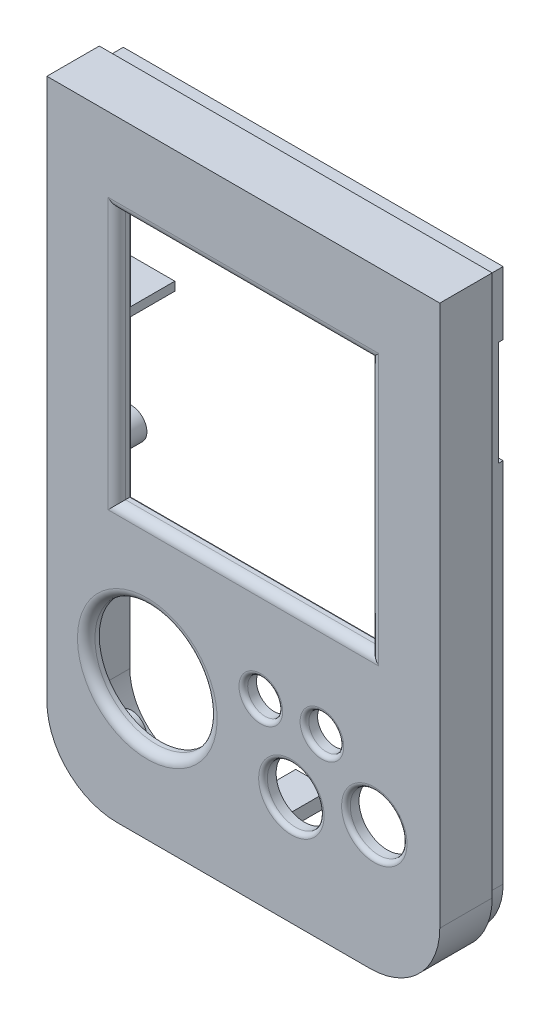
from build123d import *

# Parameters (mm, degrees)
EXTRUDE_1_DEPTH     = 8
SHELL_2_T           = -1.5
SKETCH_4_R          = 7
SKETCH_4_R_2        = 3.25
SKETCH_4_R_3        = 2
SKETCH_4_W          = 29
SKETCH_4_H          = 29
CUT_EXTRUDE_3_DEPTH = 84.600239234
FILLET_1_R          = 1
FILLET_2_R          = 1
FILLET_3_R          = 0.5
SKETCH_5_W          = 33.7
SKETCH_5_H          = 37.6
SKETCH_5_W_2        = 31.7
SKETCH_5_H_2        = 35.6
EXTRUDE_2_DEPTH     = 1.4
SKETCH_6_R          = 1.75
SKETCH_6_R_2        = 0.75
EXTRUDE_3_DEPTH     = 3.7
CUT_EXTRUDE_4_DEPTH = 2
SKETCH_8_W          = 0.75
SKETCH_8_H          = 12
CUT_EXTRUDE_5_DEPTH = 0.5
SKETCH_9_W          = 5.15
SKETCH_9_H          = 1
SKETCH_9_W_2        = 4
SKETCH_9_H_2        = 1.5
EXTRUDE_4_DEPTH     = 6.5


with BuildPart() as part:
    # 草图1 → 凸台-拉伸1 (new body)
    with BuildSketch(Plane.XY):
        with BuildLine():
            Line((-45, 70), (0, 70))
            Line((0, 70), (0, 8))
            ThreePointArc((0, 8), (-2.343145751, 2.343145751), (-8, 0))
            Line((-8, 0), (-37, 0))
            ThreePointArc((-37, 0), (-42.656854249, 2.343145751), (-45, 8))
            Line((-45, 8), (-45, 70))
        make_face()
    extrude(amount=EXTRUDE_1_DEPTH)

    # 抽壳2
    shell_2_openings = [part.faces().sort_by_distance(p)[0] for p in [
        (-22.5, 35.292176643, 0),
    ]]
    offset(amount=SHELL_2_T, openings=shell_2_openings, kind=Kind.INTERSECTION)

    # 草图4 → 切除-拉伸3 (cut, through all)
    with BuildSketch(Plane(origin=(0, 0, 0), x_dir=(-1, 0, 0), z_dir=(0, 0, -1))):
        with Locations((33.5, 16)):
            Circle(SKETCH_4_R)
        with Locations((7.5, 14.5)):
            Circle(SKETCH_4_R_2)
        with Locations((17, 12.5)):
            Circle(SKETCH_4_R_2)
        with Locations((13.5, 20.5)):
            Circle(SKETCH_4_R_3)
        with Locations((20.5, 20.5)):
            Circle(SKETCH_4_R_3)
        with Locations((22.5, 46)):
            Rectangle(SKETCH_4_W, SKETCH_4_H)
    extrude(amount=-CUT_EXTRUDE_3_DEPTH, mode=Mode.SUBTRACT)

    # 圆角1
    fillet_1_edges = [part.edges().sort_by_distance(p)[0] for p in [
        (-22.5, 60.5, 8),
        (-8, 46, 8),
        (-22.5, 31.5, 8),
        (-37, 46, 8),
    ]]
    fillet(fillet_1_edges, radius=FILLET_1_R)

    # 圆角2
    fillet_2_edges = [part.edges().sort_by_distance(p)[0] for p in [
        (-26.5, 16, 8),
    ]]
    fillet(fillet_2_edges, radius=FILLET_2_R)

    # 圆角3
    fillet_3_edges = [part.edges().sort_by_distance(p)[0] for p in [
        (-11.5, 20.5, 8),
        (-18.5, 20.5, 8),
        (-4.25, 14.5, 8),
        (-13.75, 12.5, 8),
    ]]
    fillet(fillet_3_edges, radius=FILLET_3_R)

    # 草图5 → 凸台-拉伸2 (add)
    with BuildSketch(Plane(origin=(0, 0, 6.5), x_dir=(-1, 0, 0), z_dir=(0, 0, -1))):
        with Locations((22.5, 47.95)):
            Rectangle(SKETCH_5_W, SKETCH_5_H)
        with Locations((22.5, 47.95)):
            Rectangle(SKETCH_5_W_2, SKETCH_5_H_2, mode=Mode.SUBTRACT)
    extrude(amount=EXTRUDE_2_DEPTH)

    # 草图6 → 凸台-拉伸3 (add)
    # profile 1 of 6: a face of its own
    with BuildSketch(Plane(origin=(0, 0, 6.5), x_dir=(-1, 0, 0), z_dir=(0, 0, -1))):
        with Locations((4.5, 65.5)):
            Circle(SKETCH_6_R)
        with Locations((4.5, 65.5)):
            Circle(SKETCH_6_R_2, mode=Mode.SUBTRACT)
    # profile 2 of 6: a face of its own
    with BuildSketch(Plane(origin=(0, 0, 6.5), x_dir=(-1, 0, 0), z_dir=(0, 0, -1))):
        with Locations((4.5, 35.25)):
            Circle(SKETCH_6_R)
        with Locations((4.5, 35.25)):
            Circle(SKETCH_6_R_2, mode=Mode.SUBTRACT)
    # profile 3 of 6: a face of its own
    with BuildSketch(Plane(origin=(0, 0, 6.5), x_dir=(-1, 0, 0), z_dir=(0, 0, -1))):
        with Locations((4.5, 5)):
            Circle(SKETCH_6_R)
        with Locations((4.5, 5)):
            Circle(SKETCH_6_R_2, mode=Mode.SUBTRACT)
    # profile 4 of 6: a face of its own
    with BuildSketch(Plane(origin=(0, 0, 6.5), x_dir=(-1, 0, 0), z_dir=(0, 0, -1))):
        with Locations((40.5, 5)):
            Circle(SKETCH_6_R)
        with Locations((40.5, 5)):
            Circle(SKETCH_6_R_2, mode=Mode.SUBTRACT)
    # profile 5 of 6: a face of its own
    with BuildSketch(Plane(origin=(0, 0, 6.5), x_dir=(-1, 0, 0), z_dir=(0, 0, -1))):
        with Locations((40.5, 35.25)):
            Circle(SKETCH_6_R)
        with Locations((40.5, 35.25)):
            Circle(SKETCH_6_R_2, mode=Mode.SUBTRACT)
    # profile 6 of 6: a face of its own
    with BuildSketch(Plane(origin=(0, 0, 6.5), x_dir=(-1, 0, 0), z_dir=(0, 0, -1))):
        with Locations((40.5, 65.5)):
            Circle(SKETCH_6_R)
        with Locations((40.5, 65.5)):
            Circle(SKETCH_6_R_2, mode=Mode.SUBTRACT)
    extrude(amount=EXTRUDE_3_DEPTH)

    # 草图7 → 切除-拉伸4 (cut)
    with BuildSketch(Plane(origin=(0, 0, 0), x_dir=(-1, 0, 0), z_dir=(0, 0, -1))):
        with BuildLine():
            Line((0, 70), (45, 70))
            Line((45, 70), (45, 8))
            ThreePointArc((45, 8), (42.656854249, 2.343145751), (37, 0))
            Line((37, 0), (8, 0))
            ThreePointArc((8, 0), (2.343145751, 2.343145751), (0, 8))
            Line((0, 8), (0, 70))
        make_face()
        with BuildLine():
            Line((0.75, 69.25), (44.25, 69.25))
            Line((44.25, 69.25), (44.25, 8))
            ThreePointArc((44.25, 8), (42.126524164, 2.873475836), (37, 0.75))
            Line((37, 0.75), (8, 0.75))
            ThreePointArc((8, 0.75), (2.873475836, 2.873475836), (0.75, 8))
            Line((0.75, 8), (0.75, 69.25))
        make_face(mode=Mode.SUBTRACT)
    extrude(amount=-CUT_EXTRUDE_4_DEPTH, mode=Mode.SUBTRACT)

    # 草图8 → 切除-拉伸5 (cut)
    with BuildSketch(Plane(origin=(0, 0, 0), x_dir=(-1, 0, 0), z_dir=(0, 0, -1))):
        with Locations((1.125, 56)):
            Rectangle(SKETCH_8_W, SKETCH_8_H)
    extrude(amount=-CUT_EXTRUDE_5_DEPTH, mode=Mode.SUBTRACT)

    # 草图9 → 凸台-拉伸4 (add)
    with BuildSketch(Plane(origin=(0, 0, 6.5), x_dir=(-1, 0, 0), z_dir=(0, 0, -1))):
        with Locations((40.925, 48.5)):
            Rectangle(SKETCH_9_W, SKETCH_9_H)
        with Locations((22.5, 6.75)):
            Rectangle(SKETCH_9_W_2, SKETCH_9_H_2)
    extrude(amount=EXTRUDE_4_DEPTH)


solid = part.part
